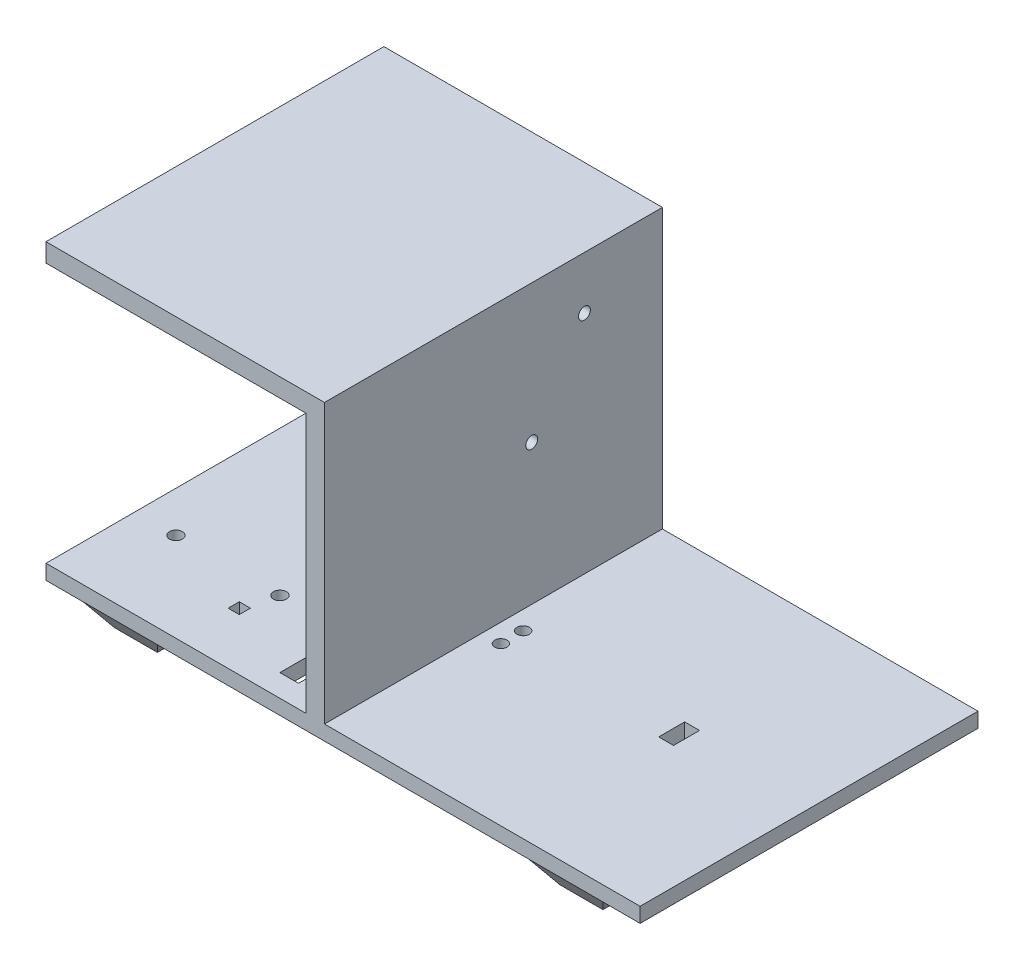
from build123d import *
from OCP.BRepFilletAPI import BRepFilletAPI_MakeChamfer

# Parameters (mm, degrees)
SKETCH1_W           = 160
SKETCH1_H           = 4
BOSS_EXTRUDE1_DEPTH = 91
SKETCH2_W           = 5
SKETCH2_H           = 75
BOSS_EXTRUDE2_DEPTH = 91
SKETCH3_W           = 91
SKETCH3_H           = 5
BOSS_EXTRUDE3_DEPTH = 70
SKETCH4_W           = 5
SKETCH4_H           = 7
CUT_EXTRUDE1_DEPTH  = 91
SKETCH5_R           = 1.75
CUT_EXTRUDE2_DEPTH  = 91
SKETCH6_W           = 3
SKETCH6_H           = 3
CUT_EXTRUDE3_DEPTH  = 91
SKETCH7_R           = 1.65
CUT_EXTRUDE4_DEPTH  = 91
SKETCH8_W           = 20
SKETCH8_H           = 20
BOSS_EXTRUDE4_DEPTH = 6
CHAMFER1_SIZE       = 6
CHAMFER1_SIZE_2     = 4.201245229
SKETCH9_W           = 20
SKETCH9_H           = 20
BOSS_EXTRUDE5_DEPTH = 6
CHAMFER2_SIZE       = 6
CHAMFER2_SIZE_2     = 4.201245229
SKETCH10_W          = 4
SKETCH10_H          = 7
CUT_EXTRUDE5_DEPTH  = 6
SKETCH11_R          = 1.6
CUT_EXTRUDE6_DEPTH  = 6


with BuildPart() as part:
    # Sketch1 → Boss-Extrude1 (new body)
    with BuildSketch(Plane.XY):
        with Locations((80, 2)):
            Rectangle(SKETCH1_W, SKETCH1_H)
    extrude(amount=-BOSS_EXTRUDE1_DEPTH)

    # Sketch2 → Boss-Extrude2 (add)
    with BuildSketch(Plane.XY):
        with Locations((72.5, 41.5)):
            Rectangle(SKETCH2_W, SKETCH2_H)
    extrude(amount=-BOSS_EXTRUDE2_DEPTH)

    # Sketch3 → Boss-Extrude3 (add)
    with BuildSketch(Plane.ZY.offset(-70)):
        with Locations((-45.5, 76.5)):
            Rectangle(SKETCH3_W, SKETCH3_H)
    extrude(amount=BOSS_EXTRUDE3_DEPTH)

    # Sketch4 → Cut-Extrude1 (cut)
    with BuildSketch(Plane(origin=(0, 4, 0), x_dir=(1, 0, 0), z_dir=(0, 1, 0))):
        with Locations((59.5, 9.5)):
            Rectangle(SKETCH4_W, SKETCH4_H)
    extrude(amount=-CUT_EXTRUDE1_DEPTH, mode=Mode.SUBTRACT)

    # Sketch5 → Cut-Extrude2 (cut)
    with BuildSketch(Plane(origin=(0, 4, 0), x_dir=(1, 0, 0), z_dir=(0, 1, 0))):
        with Locations(Location((11, 24, 0), (0, 0, 270))):
            Circle(SKETCH5_R)
        with Locations(Location((39, 24, 0), (0, 0, 270))):
            Circle(SKETCH5_R)
        with Locations(Location((6, 76, 0), (0, 0, 270))):
            Circle(SKETCH5_R)
    extrude(amount=-CUT_EXTRUDE2_DEPTH, mode=Mode.SUBTRACT)

    # Sketch6 → Cut-Extrude3 (cut)
    with BuildSketch(Plane(origin=(0, 4, 0), x_dir=(1, 0, 0), z_dir=(0, 1, 0))):
        with Locations((36.5, 15.548738613)):
            Rectangle(SKETCH6_W, SKETCH6_H)
    extrude(amount=-CUT_EXTRUDE3_DEPTH, mode=Mode.SUBTRACT)

    # Sketch7 → Cut-Extrude4 (cut)
    with BuildSketch(Plane(origin=(0, 4, 0), x_dir=(1, 0, 0), z_dir=(0, 1, 0))):
        with Locations(Location((80, 48.5, 0), (0, 0, 270))):
            Circle(SKETCH7_R)
        with Locations(Location((80, 42.5, 0), (0, 0, 270))):
            Circle(SKETCH7_R)
    extrude(amount=-CUT_EXTRUDE4_DEPTH, mode=Mode.SUBTRACT)

    # Sketch8 → Boss-Extrude4 (add)
    with BuildSketch(Plane.XZ):
        with Locations((20, -10)):
            Rectangle(SKETCH8_W, SKETCH8_H)
    extrude(amount=BOSS_EXTRUDE4_DEPTH)

    # Chamfer1
    chamfer1_edges_1 = [part.edges().sort_by_distance(p)[0] for p in [
        (30, -6, -10),
    ]]
    chamfer1_side_1 = [part.faces().sort_by_distance(p)[0] for p in [
        (30, -5.915975095, -10),
    ]]
    chamfer1_edges_2 = [part.edges().sort_by_distance(p)[0] for p in [
        (20, -6, -20),
    ]]
    chamfer1_side_2 = [part.faces().sort_by_distance(p)[0] for p in [
        (20, -5.915975095, -20),
    ]]
    chamfer1_edges_3 = [part.edges().sort_by_distance(p)[0] for p in [
        (10, -6, -10),
    ]]
    chamfer1_side_3 = [part.faces().sort_by_distance(p)[0] for p in [
        (10, -5.915975095, -10),
    ]]
    chamfer1_edges_4 = [part.edges().sort_by_distance(p)[0] for p in [
        (20, -6, 0),
    ]]
    chamfer1_side_4 = [part.faces().sort_by_distance(p)[0] for p in [
        (20, -5.915975095, 0),
    ]]
    chamfer1 = BRepFilletAPI_MakeChamfer(part.part.solid().wrapped)
    for e in chamfer1_edges_1:
        chamfer1.Add(CHAMFER1_SIZE - 0.0001, CHAMFER1_SIZE_2 - 0.0001, e.wrapped, chamfer1_side_1[0].wrapped)
    for e in chamfer1_edges_2:
        chamfer1.Add(CHAMFER1_SIZE - 0.0001, CHAMFER1_SIZE_2 - 0.0001, e.wrapped, chamfer1_side_2[0].wrapped)
    for e in chamfer1_edges_3:
        chamfer1.Add(CHAMFER1_SIZE - 0.0001, CHAMFER1_SIZE_2 - 0.0001, e.wrapped, chamfer1_side_3[0].wrapped)
    for e in chamfer1_edges_4:
        chamfer1.Add(CHAMFER1_SIZE - 0.0001, CHAMFER1_SIZE_2 - 0.0001, e.wrapped, chamfer1_side_4[0].wrapped)
    add(Compound.cast(chamfer1.Shape()), mode=Mode.REPLACE)  # a hair under: the kernel refuses the full size

    # Sketch9 → Boss-Extrude5 (add)
    with BuildSketch(Plane.XZ):
        with Locations((20, -81)):
            Rectangle(SKETCH9_W, SKETCH9_H)
        with Locations((140, -81)):
            Rectangle(SKETCH9_W, SKETCH9_H)
        with Locations((140, -10)):
            Rectangle(SKETCH9_W, SKETCH9_H)
    extrude(amount=BOSS_EXTRUDE5_DEPTH)

    # Chamfer2
    chamfer2_edges_1 = [part.edges().sort_by_distance(p)[0] for p in [
        (30, -6, -81),
    ]]
    chamfer2_side_1 = [part.faces().sort_by_distance(p)[0] for p in [
        (30, -5.915975095, -81),
    ]]
    chamfer2_edges_2 = [part.edges().sort_by_distance(p)[0] for p in [
        (20, -6, -91),
    ]]
    chamfer2_side_2 = [part.faces().sort_by_distance(p)[0] for p in [
        (20, -5.915975095, -91),
    ]]
    chamfer2_edges_3 = [part.edges().sort_by_distance(p)[0] for p in [
        (140, -6, -91),
    ]]
    chamfer2_side_3 = [part.faces().sort_by_distance(p)[0] for p in [
        (140, -5.915975095, -91),
    ]]
    chamfer2_edges_4 = [part.edges().sort_by_distance(p)[0] for p in [
        (10, -6, -81),
    ]]
    chamfer2_side_4 = [part.faces().sort_by_distance(p)[0] for p in [
        (10, -5.915975095, -81),
    ]]
    chamfer2_edges_5 = [part.edges().sort_by_distance(p)[0] for p in [
        (20, -6, -71),
    ]]
    chamfer2_side_5 = [part.faces().sort_by_distance(p)[0] for p in [
        (20, -5.915975095, -71),
    ]]
    chamfer2_edges_6 = [part.edges().sort_by_distance(p)[0] for p in [
        (150, -6, -81),
    ]]
    chamfer2_side_6 = [part.faces().sort_by_distance(p)[0] for p in [
        (150, -5.915975095, -81),
    ]]
    chamfer2_edges_7 = [part.edges().sort_by_distance(p)[0] for p in [
        (130, -6, -81),
    ]]
    chamfer2_side_7 = [part.faces().sort_by_distance(p)[0] for p in [
        (130, -5.915975095, -81),
    ]]
    chamfer2_edges_8 = [part.edges().sort_by_distance(p)[0] for p in [
        (140, -6, -71),
    ]]
    chamfer2_side_8 = [part.faces().sort_by_distance(p)[0] for p in [
        (140, -5.915975095, -71),
    ]]
    chamfer2_edges_9 = [part.edges().sort_by_distance(p)[0] for p in [
        (130, -6, -10),
    ]]
    chamfer2_side_9 = [part.faces().sort_by_distance(p)[0] for p in [
        (130, -5.915975095, -10),
    ]]
    chamfer2_edges_10 = [part.edges().sort_by_distance(p)[0] for p in [
        (140, -6, -20),
    ]]
    chamfer2_side_10 = [part.faces().sort_by_distance(p)[0] for p in [
        (140, -5.915975095, -20),
    ]]
    chamfer2_edges_11 = [part.edges().sort_by_distance(p)[0] for p in [
        (150, -6, -10),
    ]]
    chamfer2_side_11 = [part.faces().sort_by_distance(p)[0] for p in [
        (150, -5.915975095, -10),
    ]]
    chamfer2_edges_12 = [part.edges().sort_by_distance(p)[0] for p in [
        (140, -6, 0),
    ]]
    chamfer2_side_12 = [part.faces().sort_by_distance(p)[0] for p in [
        (140, -5.915975095, 0),
    ]]
    chamfer2 = BRepFilletAPI_MakeChamfer(part.part.solid().wrapped)
    for e in chamfer2_edges_1:
        chamfer2.Add(CHAMFER2_SIZE - 0.0001, CHAMFER2_SIZE_2 - 0.0001, e.wrapped, chamfer2_side_1[0].wrapped)
    for e in chamfer2_edges_2:
        chamfer2.Add(CHAMFER2_SIZE - 0.0001, CHAMFER2_SIZE_2 - 0.0001, e.wrapped, chamfer2_side_2[0].wrapped)
    for e in chamfer2_edges_3:
        chamfer2.Add(CHAMFER2_SIZE - 0.0001, CHAMFER2_SIZE_2 - 0.0001, e.wrapped, chamfer2_side_3[0].wrapped)
    for e in chamfer2_edges_4:
        chamfer2.Add(CHAMFER2_SIZE - 0.0001, CHAMFER2_SIZE_2 - 0.0001, e.wrapped, chamfer2_side_4[0].wrapped)
    for e in chamfer2_edges_5:
        chamfer2.Add(CHAMFER2_SIZE - 0.0001, CHAMFER2_SIZE_2 - 0.0001, e.wrapped, chamfer2_side_5[0].wrapped)
    for e in chamfer2_edges_6:
        chamfer2.Add(CHAMFER2_SIZE - 0.0001, CHAMFER2_SIZE_2 - 0.0001, e.wrapped, chamfer2_side_6[0].wrapped)
    for e in chamfer2_edges_7:
        chamfer2.Add(CHAMFER2_SIZE - 0.0001, CHAMFER2_SIZE_2 - 0.0001, e.wrapped, chamfer2_side_7[0].wrapped)
    for e in chamfer2_edges_8:
        chamfer2.Add(CHAMFER2_SIZE - 0.0001, CHAMFER2_SIZE_2 - 0.0001, e.wrapped, chamfer2_side_8[0].wrapped)
    for e in chamfer2_edges_9:
        chamfer2.Add(CHAMFER2_SIZE - 0.0001, CHAMFER2_SIZE_2 - 0.0001, e.wrapped, chamfer2_side_9[0].wrapped)
    for e in chamfer2_edges_10:
        chamfer2.Add(CHAMFER2_SIZE - 0.0001, CHAMFER2_SIZE_2 - 0.0001, e.wrapped, chamfer2_side_10[0].wrapped)
    for e in chamfer2_edges_11:
        chamfer2.Add(CHAMFER2_SIZE - 0.0001, CHAMFER2_SIZE_2 - 0.0001, e.wrapped, chamfer2_side_11[0].wrapped)
    for e in chamfer2_edges_12:
        chamfer2.Add(CHAMFER2_SIZE - 0.0001, CHAMFER2_SIZE_2 - 0.0001, e.wrapped, chamfer2_side_12[0].wrapped)
    add(Compound.cast(chamfer2.Shape()), mode=Mode.REPLACE)  # a hair under: the kernel refuses the full size

    # Sketch10 → Cut-Extrude5 (cut)
    with BuildSketch(Plane(origin=(0, 4, 0), x_dir=(1, 0, 0), z_dir=(0, 1, 0))):
        with Locations((125, 45.5)):
            Rectangle(SKETCH10_W, SKETCH10_H)
    extrude(amount=-CUT_EXTRUDE5_DEPTH, mode=Mode.SUBTRACT)

    # Sketch11 → Cut-Extrude6 (cut)
    with BuildSketch(Plane.ZY.offset(-70)):
        with Locations((-70, 64.80201774)):
            Circle(SKETCH11_R)
        with Locations((-55.8, 41.80201774)):
            Circle(SKETCH11_R)
    extrude(amount=-CUT_EXTRUDE6_DEPTH, mode=Mode.SUBTRACT)


solid = part.part
